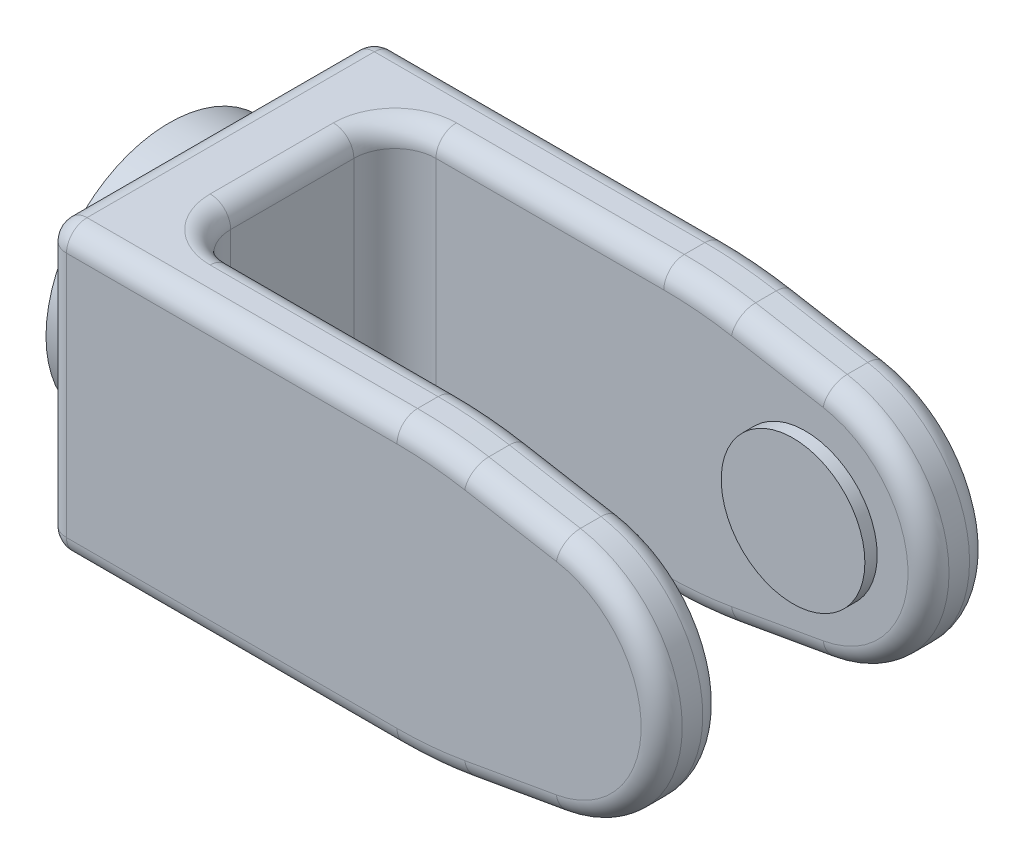
from build123d import *

# Parameters (mm, degrees)
BOSS_EXTRUDE1_DEPTH = 40
SKETCH2_W           = 180
SKETCH2_H           = 50
CUT_EXTRUDE1_DEPTH  = 171.293863659
SKETCH3_R           = 17.5
BOSS_EXTRUDE2_DEPTH = 3
SKETCH4_R           = 30
BOSS_EXTRUDE3_DEPTH = 10
SKETCH5_R           = 25
BOSS_EXTRUDE4_DEPTH = 3
FILLET1_R           = 100
FILLET2_R           = 10
FILLET3_R           = 5


with BuildPart() as part:
    # Sketch1 → Boss-Extrude1 (new, symmetric)
    with BuildSketch(Plane.XY):
        with BuildLine():
            Line((0, 0), (94.268250808, 0))
            Line((94.268250808, 0), (125.20944533, 5.45576741))
            ThreePointArc((125.20944533, 5.45576741), (150, 35), (125.20944533, 64.54423259))
            Line((125.20944533, 64.54423259), (94.268250808, 70))
            Line((94.268250808, 70), (0, 70))
            Line((0, 70), (0, 0))
        make_face()
    extrude(amount=BOSS_EXTRUDE1_DEPTH, both=True)

    # Sketch2 → Cut-Extrude1 (cut, through all)
    with BuildSketch(Plane(origin=(0, 0, 0), x_dir=(1, 0, 0), z_dir=(0, 1, 0))):
        with Locations((110, 0)):
            Rectangle(SKETCH2_W, SKETCH2_H)
    extrude(amount=CUT_EXTRUDE1_DEPTH, mode=Mode.SUBTRACT)

    # Sketch3 → Boss-Extrude2 (add)
    with BuildSketch(Plane.XY.offset(-25)):
        with Locations((120, 35)):
            Circle(SKETCH3_R)
    boss_extrude2 = extrude(amount=BOSS_EXTRUDE2_DEPTH)

    # Mirror1: Boss-Extrude2 across plane
    add(boss_extrude2.mirror(Plane.XY))

    # Sketch4 → Boss-Extrude3 (add)
    with BuildSketch(Plane.ZY):
        with Locations((0, 35)):
            Circle(SKETCH4_R)
    extrude(amount=BOSS_EXTRUDE3_DEPTH)

    # Sketch5 → Boss-Extrude4 (add)
    with BuildSketch(Plane.ZY.offset(10)):
        with Locations((0, 35)):
            Circle(SKETCH5_R)
    extrude(amount=BOSS_EXTRUDE4_DEPTH)

    # Fillet1
    fillet1_edges = [part.edges().sort_by_distance(p)[0] for p in [
        (94.268250808, 70, 32.5),
        (94.268250808, 0, 32.5),
        (94.268250808, 70, -32.5),
        (94.268250808, 0, -32.5),
    ]]
    fillet(fillet1_edges, radius=FILLET1_R)

    # Fillet2
    fillet2_edges = [part.edges().sort_by_distance(p)[0] for p in [
        (20, 35, 25),
        (20, 35, -25),
    ]]
    fillet(fillet2_edges, radius=FILLET2_R)

    # Fillet3
    fillet3_edges = [part.edges().sort_by_distance(p)[0] for p in [
        (0, 70, 0),
        (0, 0, 0),
        (150, 35, 40),
        (114.046823776, 66.512503946, 40),
        (150, 35, 25),
        (114.046823776, 3.487496054, 25),
        (150, 35, -25),
        (114.046823776, 66.512503946, -25),
        (0, 35, 40),
        (114.046823776, 3.487496054, -25),
        (114.046823776, 3.487496054, -40),
        (114.046823776, 66.512503946, -40),
        (42.759692228, 70, -40),
        (94.23495873, 69.619469809, -40),
        (94.23495873, 0.380530191, -40),
        (57.759692228, 0, -25),
        (150, 35, -40),
        (42.759692228, 0, 40),
        (57.759692228, 70, -25),
        (94.23495873, 69.619469809, -25),
        (94.23495873, 0.380530191, -25),
        (114.046823776, 3.487496054, 40),
        (114.046823776, 66.512503946, 25),
        (94.23495873, 69.619469809, 25),
        (94.23495873, 0.380530191, 25),
        (42.759692228, 70, 40),
        (94.23495873, 69.619469809, 40),
        (94.23495873, 0.380530191, 40),
        (42.759692228, 0, -40),
        (0, 35, -40),
        (20, 0, 0),
        (20, 70, 0),
        (57.759692228, 0, 25),
        (57.759692228, 70, 25),
        (22.928932188, 0, -22.071067812),
        (22.928932188, 70, -22.071067812),
        (22.928932188, 0, 22.071067812),
        (22.928932188, 70, 22.071067812),
    ]]
    fillet(fillet3_edges, radius=FILLET3_R - 0.0001)  # a hair under: the kernel refuses the full size


solid = part.part
